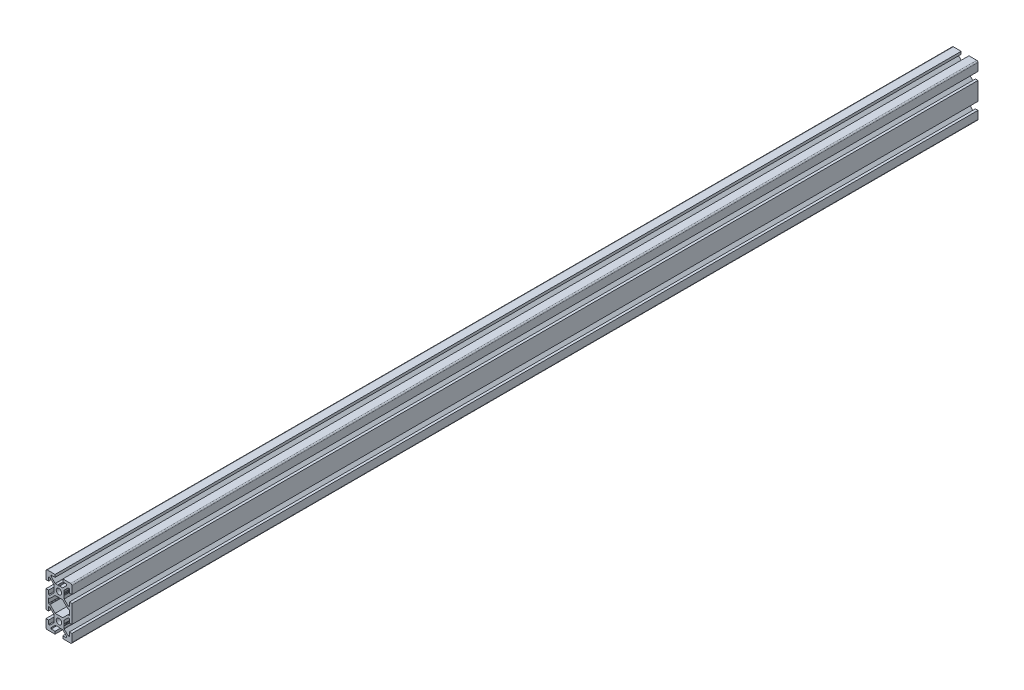
from build123d import *

# Parameters (mm, degrees)
SKETCH1_R           = 2.1
BOSS_EXTRUDE1_DEPTH = 700
SKETCH2_R           = 2
CUT_EXTRUDE1_DEPTH  = 601.666296707


with BuildPart() as part:
    # Sketch1 → Boss-Extrude1 (new body)
    with BuildSketch(Plane(origin=(0, 0, -600), x_dir=(-1, 0, 0), z_dir=(0, 0, -1))):
        with BuildLine():
            Line((10, -7), (10, 7))
            Line((10, 7), (8, 7))
            Line((8, 7), (8, 4))
            Line((8, 4), (7.060660172, 4))
            Line((7.060660172, 4), (4, 7.060660172))
            Line((4, 7.060660172), (4, 7.5))
            Line((4, 7.5), (3.750976592, 8.781114371))
            Line((3.750976592, 8.781114371), (3.933012702, 9.096410162))
            ThreePointArc((3.933012702, 9.096410162), (4, 9.346410162), (3.933012702, 9.596410162))
            Line((3.933012702, 9.596410162), (3.7, 10))
            Line((3.7, 10), (3.933012702, 10.403589838))
            ThreePointArc((3.933012702, 10.403589838), (3.982962913, 10.524180316), (4, 10.653589838))
            Line((4, 10.653589838), (4, 12.939339828))
            Line((4, 12.939339828), (7.060660172, 16))
            Line((7.060660172, 16), (8, 16))
            Line((8, 16), (8, 13))
            Line((8, 13), (10, 13))
            Line((10, 13), (10, 19))
            ThreePointArc((10, 19), (9.707106781, 19.707106781), (9, 20))
            Line((9, 20), (3, 20))
            Line((3, 20), (3, 18))
            Line((3, 18), (6, 18))
            Line((6, 18), (6, 17.060660172))
            Line((6, 17.060660172), (2.939339828, 14))
            Line((2.939339828, 14), (2.5, 14))
            Line((2.5, 14), (1.218885629, 13.750976592))
            Line((1.218885629, 13.750976592), (0.903589838, 13.933012702))
            ThreePointArc((0.903589838, 13.933012702), (0.653589838, 14), (0.403589838, 13.933012702))
            Line((0.403589838, 13.933012702), (0, 13.7))
            Line((0, 13.7), (-0.403589838, 13.933012702))
            ThreePointArc((-0.403589838, 13.933012702), (-0.524180316, 13.982962913), (-0.653589838, 14))
            Line((-0.653589838, 14), (-2.939339828, 14))
            Line((-2.939339828, 14), (-6, 17.060660172))
            Line((-6, 17.060660172), (-6, 18))
            Line((-6, 18), (-3, 18))
            Line((-3, 18), (-3, 20))
            Line((-3, 20), (-9, 20))
            ThreePointArc((-9, 20), (-9.707106781, 19.707106781), (-10, 19))
            Line((-10, 19), (-10, 13))
            Line((-10, 13), (-8, 13))
            Line((-8, 13), (-8, 16))
            Line((-8, 16), (-7.060660172, 16))
            Line((-7.060660172, 16), (-4, 12.939339828))
            Line((-4, 12.939339828), (-4, 12.5))
            Line((-4, 12.5), (-3.750976592, 11.218885629))
            Line((-3.750976592, 11.218885629), (-3.933012702, 10.903589838))
            ThreePointArc((-3.933012702, 10.903589838), (-4, 10.653589838), (-3.933012702, 10.403589838))
            Line((-3.933012702, 10.403589838), (-3.7, 10))
            Line((-3.7, 10), (-3.933012702, 9.596410162))
            ThreePointArc((-3.933012702, 9.596410162), (-3.982962913, 9.475819684), (-4, 9.346410162))
            Line((-4, 9.346410162), (-4, 7.060660172))
            Line((-4, 7.060660172), (-7.060660172, 4))
            Line((-7.060660172, 4), (-8, 4))
            Line((-8, 4), (-8, 7))
            Line((-8, 7), (-10, 7))
            Line((-10, 7), (-10, -7))
            Line((-10, -7), (-8, -7))
            Line((-8, -7), (-8, -4))
            Line((-8, -4), (-7.060660172, -4))
            Line((-7.060660172, -4), (-4, -7.060660172))
            Line((-4, -7.060660172), (-4, -9.346410162))
            ThreePointArc((-4, -9.346410162), (-3.982962913, -9.475819684), (-3.933012702, -9.596410162))
            Line((-3.933012702, -9.596410162), (-3.7, -10))
            Line((-3.7, -10), (-3.933012702, -10.403589838))
            ThreePointArc((-3.933012702, -10.403589838), (-4, -10.653589838), (-3.933012702, -10.903589838))
            Line((-3.933012702, -10.903589838), (-3.750976592, -11.218885629))
            Line((-3.750976592, -11.218885629), (-4, -12.5))
            Line((-4, -12.5), (-4, -12.939339828))
            Line((-4, -12.939339828), (-7.060660172, -16))
            Line((-7.060660172, -16), (-8, -16))
            Line((-8, -16), (-8, -13))
            Line((-8, -13), (-10, -13))
            Line((-10, -13), (-10, -19))
            ThreePointArc((-10, -19), (-9.707106781, -19.707106781), (-9, -20))
            Line((-9, -20), (-3, -20))
            Line((-3, -20), (-3, -18))
            Line((-3, -18), (-6, -18))
            Line((-6, -18), (-6, -17.060660172))
            Line((-6, -17.060660172), (-2.939339828, -14))
            Line((-2.939339828, -14), (-0.653589838, -14))
            ThreePointArc((-0.653589838, -14), (-0.524180316, -13.982962913), (-0.403589838, -13.933012702))
            Line((-0.403589838, -13.933012702), (0, -13.7))
            Line((0, -13.7), (0.403589839, -13.933012702))
            ThreePointArc((0.403589839, -13.933012702), (0.653589839, -14), (0.903589838, -13.933012702))
            Line((0.903589838, -13.933012702), (1.218885629, -13.750976592))
            Line((1.218885629, -13.750976592), (2.5, -14))
            Line((2.5, -14), (2.939339828, -14))
            Line((2.939339828, -14), (6, -17.060660172))
            Line((6, -17.060660172), (6, -18))
            Line((6, -18), (3, -18))
            Line((3, -18), (3, -20))
            Line((3, -20), (9, -20))
            ThreePointArc((9, -20), (9.707106781, -19.707106781), (10, -19))
            Line((10, -19), (10, -13))
            Line((10, -13), (8, -13))
            Line((8, -13), (8, -16))
            Line((8, -16), (7.060660172, -16))
            Line((7.060660172, -16), (4, -12.939339828))
            Line((4, -12.939339828), (4, -10.653589838))
            ThreePointArc((4, -10.653589838), (3.982962913, -10.524180316), (3.933012702, -10.403589838))
            Line((3.933012702, -10.403589838), (3.7, -10))
            Line((3.7, -10), (3.933012702, -9.596410162))
            ThreePointArc((3.933012702, -9.596410162), (4, -9.346410162), (3.933012702, -9.096410162))
            Line((3.933012702, -9.096410162), (3.750976592, -8.781114371))
            Line((3.750976592, -8.781114371), (4, -7.5))
            Line((4, -7.5), (4, -7.060660172))
            Line((4, -7.060660172), (7.060660172, -4))
            Line((7.060660172, -4), (8, -4))
            Line((8, -4), (8, -7))
            Line((8, -7), (10, -7))
        make_face()
        with Locations((0, -10)):
            Circle(SKETCH1_R, mode=Mode.SUBTRACT)
        with Locations((0, 10)):
            Circle(SKETCH1_R, mode=Mode.SUBTRACT)
        with BuildLine():
            Line((8, 1.7), (8, -1.7))
            ThreePointArc((8, -1.7), (7.912132034, -1.912132034), (7.7, -2))
            Line((7.7, -2), (7.063603897, -2))
            ThreePointArc((7.063603897, -2), (6.948798867, -2.02283614), (6.851471863, -2.087867966))
            Line((6.851471863, -2.087867966), (2.939339828, -6))
            Line((2.939339828, -6), (-2.939339828, -6))
            Line((-2.939339828, -6), (-6.851471863, -2.087867966))
            ThreePointArc((-6.851471863, -2.087867966), (-6.948798867, -2.02283614), (-7.063603897, -2))
            Line((-7.063603897, -2), (-7.7, -2))
            ThreePointArc((-7.7, -2), (-7.912132034, -1.912132034), (-8, -1.7))
            Line((-8, -1.7), (-8, 1.7))
            ThreePointArc((-8, 1.7), (-7.912132034, 1.912132034), (-7.7, 2))
            Line((-7.7, 2), (-7.063603897, 2))
            ThreePointArc((-7.063603897, 2), (-6.948798867, 2.02283614), (-6.851471863, 2.087867966))
            Line((-6.851471863, 2.087867966), (-2.939339828, 6))
            Line((-2.939339828, 6), (2.939339828, 6))
            Line((2.939339828, 6), (6.851471863, 2.087867966))
            ThreePointArc((6.851471863, 2.087867966), (6.948798867, 2.02283614), (7.063603897, 2))
            Line((7.063603897, 2), (7.7, 2))
            ThreePointArc((7.7, 2), (7.912132034, 1.912132034), (8, 1.7))
        make_face(mode=Mode.SUBTRACT)
    extrude(amount=-BOSS_EXTRUDE1_DEPTH)

    # Sketch2 → Cut-Extrude1 (cut, through all)
    with BuildSketch(Plane.ZY.offset(10)):
        with Locations((90, 10)):
            Circle(SKETCH2_R)
        with Locations((90, -10)):
            Circle(SKETCH2_R)
    cut_extrude1 = extrude(amount=-CUT_EXTRUDE1_DEPTH, mode=Mode.SUBTRACT)

    # Mirror1: Cut-Extrude1 across plane
    add(cut_extrude1.mirror(Plane.XY.offset(-250)), mode=Mode.SUBTRACT)


solid = part.part
